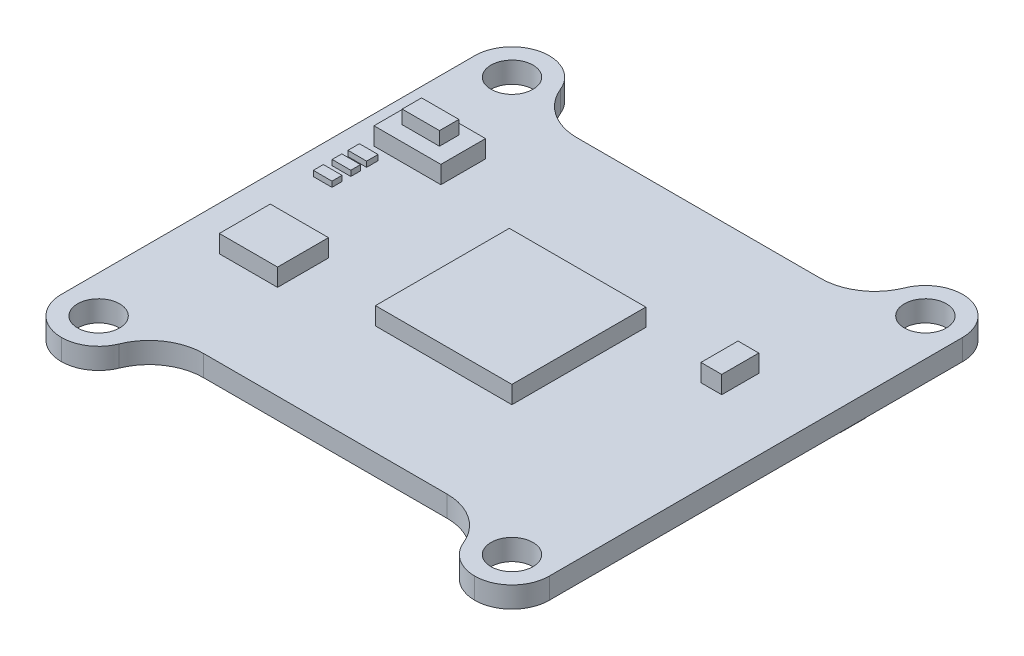
from build123d import *

# Parameters (mm, degrees)
SKETCH1_R           = 1.55
BOSS_EXTRUDE1_DEPTH = 1.55
FILLET1_R           = 2.75
FILLET2_R           = 4
SKETCH2_W           = 4.295601851
SKETCH2_H           = 3.758651621
SKETCH2_W_2         = 10.067816841
SKETCH2_H_2         = 9.880137001
SKETCH2_W_3         = 1.533271648
SKETCH2_H_3         = 2.732965052
SKETCH2_W_4         = 4.933230252
SKETCH2_H_4         = 3.296205995
BOSS_EXTRUDE2_DEPTH = 1.3
SKETCH3_W           = 2.751869936
SKETCH3_H           = 1.431170206
BOSS_EXTRUDE3_DEPTH = 1
SKETCH5_W           = 15.136693504
SKETCH5_H           = 14.663476204
SKETCH5_W_2         = 3.786204625
SKETCH5_H_2         = 3.249978942
SKETCH5_W_3         = 1.854200636
SKETCH5_H_3         = 2.974253985
SKETCH5_W_4         = 1.124105555
SKETCH5_H_4         = 1.832284905
SKETCH5_W_5         = 2.879214045
SKETCH5_H_5         = 1.227517325
SKETCH5_W_6         = 1.439607023
SKETCH5_H_6         = 2.644088496
SKETCH5_W_7         = 1.062909192
SKETCH5_H_7         = 1.901844146
BOSS_EXTRUDE5_DEPTH = 1.36
SKETCH6_W           = 1.377049396
SKETCH6_H           = 0.847415013
SKETCH6_H_2         = 0.715006417
SKETCH6_H_3         = 0.741488137
LED_DEPTH           = 0.4


with BuildPart() as part:
    # Sketch1 → Boss-Extrude1 (new body)
    with BuildSketch(Plane(origin=(0, 0, 0), x_dir=(1, 0, 0), z_dir=(0, 1, 0))):
        Polygon((-12.5, 18), (-18, 18), (-18, -18), (-12.5, -18), (-12.5, -13.78), (12.5, -13.78), (12.5, -18), (18, -18), (18, 18), (12.5, 18), (12.5, 13.78), (-12.5, 13.78), align=None)
        with Locations(Location((-15.25, -15.25, 0), (0, 0, 90))):
            Circle(SKETCH1_R, mode=Mode.SUBTRACT)
        with Locations(Location((15.25, -15.25, 0), (0, 0, 90))):
            Circle(SKETCH1_R, mode=Mode.SUBTRACT)
        with Locations(Location((-15.25, 15.25, 0), (0, 0, 90))):
            Circle(SKETCH1_R, mode=Mode.SUBTRACT)
        with Locations(Location((15.25, 15.25, 0), (0, 0, 90))):
            Circle(SKETCH1_R, mode=Mode.SUBTRACT)
    extrude(amount=BOSS_EXTRUDE1_DEPTH)

    # Fillet1
    fillet1_edges = [part.edges().sort_by_distance(p)[0] for p in [
        (-12.5, 0.775, -18),
        (-18, 0.775, -18),
        (-18, 0.775, 18),
        (-12.5, 0.775, 18),
        (12.5, 0.775, 18),
        (18, 0.775, 18),
        (18, 0.775, -18),
        (12.5, 0.775, -18),
    ]]
    fillet(fillet1_edges, radius=FILLET1_R - 0.0001)  # a hair under: the kernel refuses the full size

    # Fillet2
    fillet2_edges = [part.edges().sort_by_distance(p)[0] for p in [
        (12.5, 0.775, -13.78),
        (-12.5, 0.775, -13.78),
        (12.5, 0.775, 13.78),
        (-12.5, 0.775, 13.78),
    ]]
    fillet(fillet2_edges, radius=FILLET2_R)

    # Sketch2 → Boss-Extrude2 (add)
    with BuildSketch(Plane(origin=(0, 1.55, 0), x_dir=(1, 0, 0), z_dir=(0, 1, 0))):
        with Locations((-12.61578846, -4.950009947)):
            Rectangle(SKETCH2_W, SKETCH2_H)
        with Locations((0.64017038, -0.742248111)):
            Rectangle(SKETCH2_W_2, SKETCH2_H_2)
        with Locations((12.011098572, 4.06360308)):
            Rectangle(SKETCH2_W_3, SKETCH2_H_3)
        with Locations((-13.471552891, 7.404508181)):
            Rectangle(SKETCH2_W_4, SKETCH2_H_4)
    extrude(amount=BOSS_EXTRUDE2_DEPTH)

    # Sketch3 → Boss-Extrude3 (add)
    with BuildSketch(Plane(origin=(0, 2.85, 0), x_dir=(1, 0, 0), z_dir=(0, 1, 0))):
        with Locations((-13.589010754, 7.578480249)):
            Rectangle(SKETCH3_W, SKETCH3_H)
    extrude(amount=BOSS_EXTRUDE3_DEPTH)

    # Sketch5 → Boss-Extrude5 (add)
    with BuildSketch(Plane.XZ):
        with Locations((-10.431653248, 0.794028878)):
            Rectangle(SKETCH5_W, SKETCH5_H)
        with Locations((12.566755317, -8.673138409)):
            Rectangle(SKETCH5_W_2, SKETCH5_H_2)
        with Locations((13.887030707, -2.780074404)):
            Rectangle(SKETCH5_W_3, SKETCH5_H_3)
        with Locations((11.235705782, -2.742909061)):
            Rectangle(SKETCH5_W_4, SKETCH5_H_4)
        with Locations((-1.024391328, -3.653442734)):
            Rectangle(SKETCH5_W_5, SKETCH5_H_5)
        with Locations((-0.304587816, 2.835875505)):
            Rectangle(SKETCH5_W_6, SKETCH5_H_6)
        with Locations((16.130877107, -8.512116058)):
            Rectangle(SKETCH5_W_7, SKETCH5_H_7)
    extrude(amount=BOSS_EXTRUDE5_DEPTH)

    # Sketch6 → LED (add)
    with BuildSketch(Plane(origin=(0, 1.55, 0), x_dir=(1, 0, 0), z_dir=(0, 1, 0))):
        with Locations((-15.541502651, 4.54846251)):
            Rectangle(SKETCH6_W, SKETCH6_H)
        with Locations((-15.541502651, 3.317062568)):
            Rectangle(SKETCH6_W, SKETCH6_H_2)
        with Locations((-15.541502651, 1.940013173)):
            Rectangle(SKETCH6_W, SKETCH6_H_3)
    extrude(amount=LED_DEPTH)


solid = part.part
